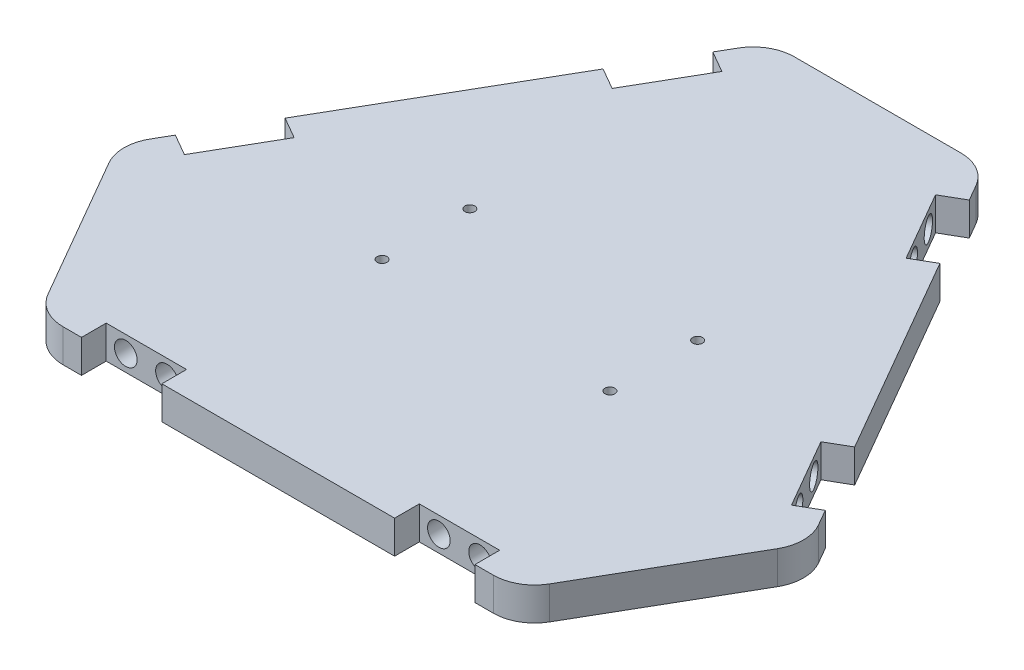
from build123d import *

# Parameters (mm, degrees)
BOSS_EXTRUDE1_DEPTH            = 4
CHAMFER1_SIZE                  = 52
SKETCH4_W                      = 19.5
SKETCH4_H                      = 8
SKETCH4_R                      = 2
CUT_EXTRUDE1_DEPTH             = 6
SKETCH4_2_R                    = 2
CUT_EXTRUDE2_DEPTH             = 16
SKETCH9_R                      = 2.75
CUT_EXTRUDE3_DEPTH             = 7
CRVPATTERN1_START              = -63.508529611
CRVPATTERN1_OUTLINE_W          = 19.5
CRVPATTERN1_OUTLINE_H          = 8
CRVPATTERN1_DEPTH              = 6
CRVPATTERN1_START_2            = -57.508529611
CRVPATTERN1_2_OUTLINE_R        = 2.75
CRVPATTERN1_2_DEPTH            = 7
CRVPATTERN1_START_3            = -50.508529611
CRVPATTERN1_3_OUTLINE_R        = 2
CRVPATTERN1_3_DEPTH            = 3
CRVPATTERN1_START_4            = 57.508529611
CRVPATTERN1_4_OUTLINE_W        = 19.5
CRVPATTERN1_4_OUTLINE_H        = 8
CRVPATTERN1_4_DEPTH            = 6
CRVPATTERN1_START_5            = 50.508529611
CRVPATTERN1_5_OUTLINE_R        = 2.75
CRVPATTERN1_5_DEPTH            = 7
CRVPATTERN1_START_6            = 47.508529611
CRVPATTERN1_6_OUTLINE_R        = 2
CRVPATTERN1_6_DEPTH            = 3
FILLET1_R                      = 10
CBORE_FOR_M2_SHCS1_D           = 2.4
CBORE_FOR_M2_SHCS1_CBORE_D     = 4.4
CBORE_FOR_M2_SHCS1_CBORE_DEPTH = 2


# Read off the part's stored shape, not the designer's step: CrvPattern1
with BuildPart() as part:
    # Sketch1 → Boss-Extrude1 (new, symmetric)
    with BuildSketch(Plane(origin=(0, 0, 0), x_dir=(1, 0, 0), z_dir=(0, 1, 0))):
        Polygon((110, -63.508529611), (0, 127.017059222), (-110, -63.508529611), align=None)
    extrude(amount=BOSS_EXTRUDE1_DEPTH, both=True)

    # Chamfer1
    chamfer1_edges = [part.edges().sort_by_distance(p)[0] for p in [
        (-110, 0, 63.508529611),
        (0, 0, -127.017059222),
        (110, 0, 63.508529611),
    ]]
    chamfer(chamfer1_edges, length=CHAMFER1_SIZE)

    # Sketch4 → Cut-Extrude1 (cut)
    with BuildSketch(Plane(origin=(4.375288244, 0, 63.508529611), x_dir=(-1, 0, 0), z_dir=(0, 0, -1))):
        with Locations((42.375288244, 0)):
            Rectangle(SKETCH4_W, SKETCH4_H)
        with Locations((37.375288244, 0)):
            Circle(SKETCH4_R, mode=Mode.SUBTRACT)
        with Locations((47.375288244, 0)):
            Circle(SKETCH4_R, mode=Mode.SUBTRACT)
    cut_extrude1 = extrude(amount=CUT_EXTRUDE1_DEPTH, mode=Mode.SUBTRACT)

    # Sketch4<2> → Cut-Extrude2 (cut)
    with BuildSketch(Plane(origin=(4.375288244, 0, 63.508529611), x_dir=(-1, 0, 0), z_dir=(0, 0, -1))):
        with Locations((47.375288244, 0)):
            Circle(SKETCH4_2_R)
        with Locations((37.375288244, 0)):
            Circle(SKETCH4_2_R)
    cut_extrude2 = extrude(amount=CUT_EXTRUDE2_DEPTH, mode=Mode.SUBTRACT)

    # Sketch9 → Cut-Extrude3 (cut)
    with BuildSketch(Plane.XY.offset(57.508529611)):
        with Locations((-43, 0)):
            Circle(SKETCH9_R)
        with Locations((-33, 0)):
            Circle(SKETCH9_R)
    cut_extrude3 = extrude(amount=-CUT_EXTRUDE3_DEPTH, mode=Mode.SUBTRACT)

    # Mirror1: Cut-Extrude1, Cut-Extrude2, Cut-Extrude3 across plane
    add(cut_extrude1.mirror(Plane(origin=(0, 0, 0), x_dir=(0, 0, 1), z_dir=(1, 0, 0))), mode=Mode.SUBTRACT)
    add(cut_extrude2.mirror(Plane(origin=(0, 0, 0), x_dir=(0, 0, 1), z_dir=(1, 0, 0))), mode=Mode.SUBTRACT)
    add(cut_extrude3.mirror(Plane(origin=(0, 0, 0), x_dir=(0, 0, 1), z_dir=(1, 0, 0))), mode=Mode.SUBTRACT)

    # CrvPattern1 outline → CrvPattern1 (cut)
    with BuildSketch(Plane(origin=(0, 0, 0), x_dir=(0.499999999999987, 0, -0.8660254037844463), z_dir=(0.8660254037844461, 0, 0.49999999999998707)).offset(CRVPATTERN1_START)):
        with Locations((-38, 0)):
            Rectangle(CRVPATTERN1_OUTLINE_W, CRVPATTERN1_OUTLINE_H)
        with Locations((38, 0)):
            Rectangle(CRVPATTERN1_OUTLINE_W, CRVPATTERN1_OUTLINE_H)
    extrude(amount=CRVPATTERN1_DEPTH, mode=Mode.SUBTRACT)

    # CrvPattern1 2 outline → CrvPattern1 2 (cut)
    with BuildSketch(Plane(origin=(0, 0, 0), x_dir=(0.499999999999987, 0, -0.8660254037844463), z_dir=(0.8660254037844461, 0, 0.49999999999998707)).offset(CRVPATTERN1_START_2)):
        with Locations((-43, 0)):
            Circle(CRVPATTERN1_2_OUTLINE_R)
        with Locations((-33, 0)):
            Circle(CRVPATTERN1_2_OUTLINE_R)
        with Locations((33, 0)):
            Circle(CRVPATTERN1_2_OUTLINE_R)
        with Locations((43, 0)):
            Circle(CRVPATTERN1_2_OUTLINE_R)
    extrude(amount=CRVPATTERN1_2_DEPTH, mode=Mode.SUBTRACT)

    # CrvPattern1 3 outline → CrvPattern1 3 (cut)
    with BuildSketch(Plane(origin=(0, 0, 0), x_dir=(0.499999999999987, 0, -0.8660254037844463), z_dir=(0.8660254037844461, 0, 0.49999999999998707)).offset(CRVPATTERN1_START_3)):
        with Locations((-43, 0)):
            Circle(CRVPATTERN1_3_OUTLINE_R)
        with Locations((-33, 0)):
            Circle(CRVPATTERN1_3_OUTLINE_R)
        with Locations((33, 0)):
            Circle(CRVPATTERN1_3_OUTLINE_R)
        with Locations((43, 0)):
            Circle(CRVPATTERN1_3_OUTLINE_R)
    extrude(amount=CRVPATTERN1_3_DEPTH, mode=Mode.SUBTRACT)

    # CrvPattern1 4 outline → CrvPattern1 4 (cut)
    with BuildSketch(Plane(origin=(0, 0, 0), x_dir=(0.500000000000001, 0, 0.866025403784438), z_dir=(0.866025403784438, 0, -0.500000000000001)).offset(CRVPATTERN1_START_4)):
        with Locations((-38, 0)):
            Rectangle(CRVPATTERN1_4_OUTLINE_W, CRVPATTERN1_4_OUTLINE_H)
        with Locations((38, 0)):
            Rectangle(CRVPATTERN1_4_OUTLINE_W, CRVPATTERN1_4_OUTLINE_H)
    extrude(amount=CRVPATTERN1_4_DEPTH, mode=Mode.SUBTRACT)

    # CrvPattern1 5 outline → CrvPattern1 5 (cut)
    with BuildSketch(Plane(origin=(0, 0, 0), x_dir=(0.500000000000001, 0, 0.866025403784438), z_dir=(0.866025403784438, 0, -0.500000000000001)).offset(CRVPATTERN1_START_5)):
        with Locations((-43, 0)):
            Circle(CRVPATTERN1_5_OUTLINE_R)
        with Locations((-33, 0)):
            Circle(CRVPATTERN1_5_OUTLINE_R)
        with Locations((33, 0)):
            Circle(CRVPATTERN1_5_OUTLINE_R)
        with Locations((43, 0)):
            Circle(CRVPATTERN1_5_OUTLINE_R)
    extrude(amount=CRVPATTERN1_5_DEPTH, mode=Mode.SUBTRACT)

    # CrvPattern1 6 outline → CrvPattern1 6 (cut)
    with BuildSketch(Plane(origin=(0, 0, 0), x_dir=(0.500000000000001, 0, 0.866025403784438), z_dir=(0.866025403784438, 0, -0.500000000000001)).offset(CRVPATTERN1_START_6)):
        with Locations((-43, 0)):
            Circle(CRVPATTERN1_6_OUTLINE_R)
        with Locations((-33, 0)):
            Circle(CRVPATTERN1_6_OUTLINE_R)
        with Locations((33, 0)):
            Circle(CRVPATTERN1_6_OUTLINE_R)
        with Locations((43, 0)):
            Circle(CRVPATTERN1_6_OUTLINE_R)
    extrude(amount=CRVPATTERN1_6_DEPTH, mode=Mode.SUBTRACT)

    # Fillet1
    fillet1_edges = [part.edges().sort_by_distance(p)[0] for p in [
        (58, 0, 63.508529611),
        (-58, 0, 63.508529611),
        (-26, 0, -81.983738225),
        (-84, 0, 18.475208614),
        (26, 0, -81.983738225),
        (84, 0, 18.475208614),
    ]]
    fillet(fillet1_edges, radius=FILLET1_R)

    # CBORE for M2 SHCS1 (through all)
    with Locations(Plane(origin=(0, -4, 0), x_dir=(-1, 0, 0), z_dir=(0, -1, 0))):
        with Locations((-27.65, -10.65), (27.65, 10.65), (27.65, -10.65), (-27.65, 10.65)):
            CounterBoreHole(CBORE_FOR_M2_SHCS1_D / 2, CBORE_FOR_M2_SHCS1_CBORE_D / 2, CBORE_FOR_M2_SHCS1_CBORE_DEPTH)


solid = part.part
